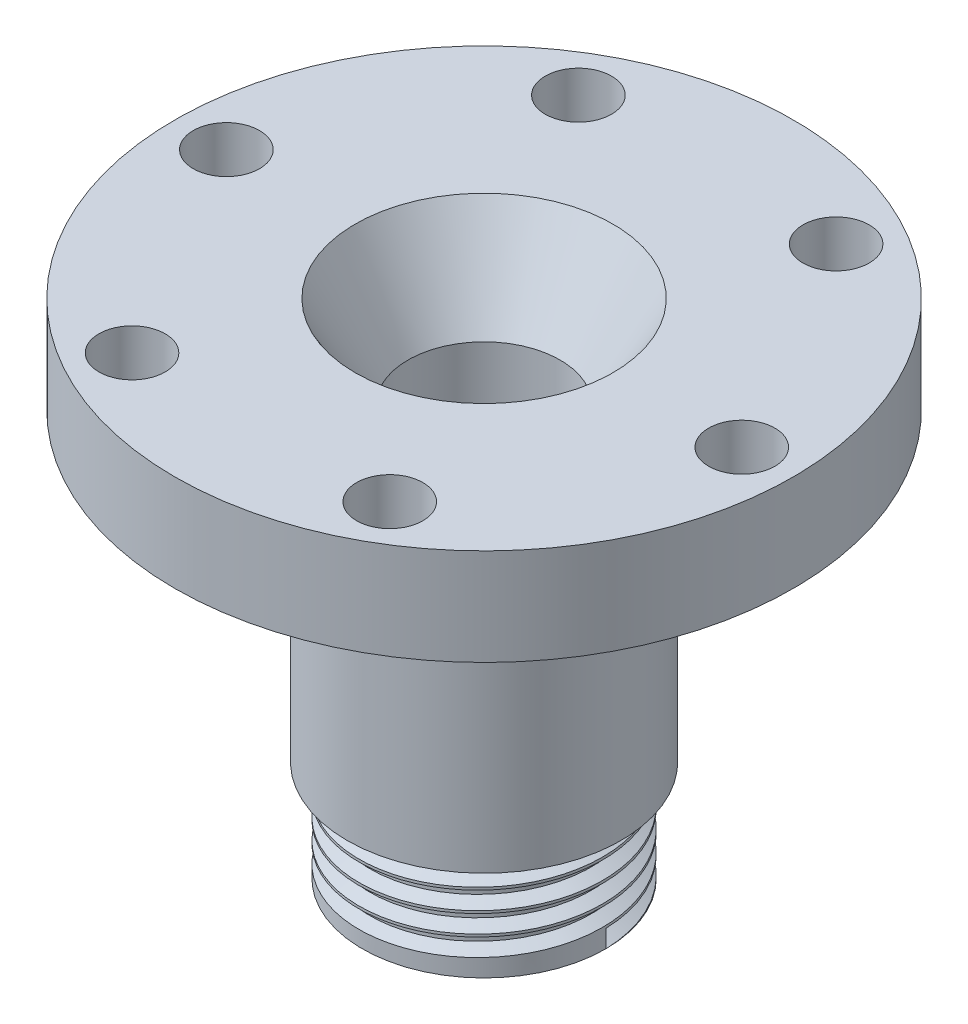
from build123d import *

# Parameters (mm, degrees)
F_1_4_CLEARANCE_HOLE1_D = 6.5278
CIRPATTERN1_COUNT       = 6
CHAMFER2_SIZE           = 3.175
SKETCH6_R               = 14.166458521
SKETCH6_R_2             = 12
CUT_EXTRUDE1_DEPTH      = 10
THREAD1_PITCH           = 2


with BuildPart() as part:
    # Sketch1 → Revolve1 (revolve)
    with BuildSketch(Plane.XY, mode=Mode.PRIVATE) as revolve1_sk:
        Polygon((7.5, -49.525), (7.5, -9.006664199), (12.7, 0), (30.48, 0), (30.48, -9.525), (13.5, -9.525), (13.5, -49.525), align=None)
    revolve(revolve1_sk.sketch.rotate(Axis((0, 0, 0), (0, -1, 0)), 90), axis=Axis((0, 0, 0), (0, -1, 0)))

    # 1/4 Clearance Hole1 (through all)
    with Locations(Plane(origin=(0, 0, 0), x_dir=(1, 0, 0), z_dir=(0, 1, 0))):
        with Locations((25.4, 0)):
            f_1_4_clearance_hole1 = Hole(F_1_4_CLEARANCE_HOLE1_D / 2)

    # CirPattern1: 1/4 Clearance Hole1 ×6 about axis
    cirpattern1_axis = Axis((0, 0, 0), (0, 1, 0))
    for i in range(1, CIRPATTERN1_COUNT):
        add(f_1_4_clearance_hole1.rotate(cirpattern1_axis, i * 360 / CIRPATTERN1_COUNT), mode=Mode.SUBTRACT)

    # Chamfer2
    chamfer2_edges = [part.edges().sort_by_distance(p)[0] for p in [
        (0, -9.525, -13.5),
    ]]
    chamfer(chamfer2_edges, length=CHAMFER2_SIZE)

    # Sketch6 → Cut-Extrude1 (cut)
    with BuildSketch(Plane(origin=(0, -49.525, 0), x_dir=(-1, 0, 0), z_dir=(0, -1, 0))):
        Circle(SKETCH6_R)
        with Locations(Location((0, 0, 0), (0, 0, 90))):
            Circle(SKETCH6_R_2, mode=Mode.SUBTRACT)
    extrude(amount=-CUT_EXTRUDE1_DEPTH, mode=Mode.SUBTRACT)

    # Thread1: the profile of Thread Profile2 profile screwed along a right-hand helix of 5 turns, 10 arcs to a turn; built about Z, then put on its axis
    thread1_z = Axis((0, 0, 0), (0, 0, 1))
    thread1_corners = [(12.0003, 0, -0.000173205), (12.0003, 0, 1.7501732), (10.91746825, 0, 1.124999997), (10.91746825, 0, 0.624999997)]
    with BuildLine(mode=Mode.PRIVATE) as thread1_profile:
        Line(thread1_corners[0], thread1_corners[1])
        Line(thread1_corners[1], thread1_corners[2])
        Line(thread1_corners[2], thread1_corners[3])
        Line(thread1_corners[3], thread1_corners[0])
    thread1_cap = Face(thread1_profile.wire())
    thread1_turn_angles = [0, 18, 36, 54, 72, 90, 108, 126, 144, 162, 180, 198, 216, 234, 252, 270, 288, 306, 324, 342, 360]
    thread1_turn_weights = [1, 0.9510565162951535, 1, 0.9510565162951535, 1, 0.9510565162951535, 1, 0.9510565162951535, 1, 0.9510565162951535, 1, 0.9510565162951535, 1, 0.9510565162951535, 1, 0.9510565162951535, 1, 0.9510565162951535, 1, 0.9510565162951535, 1]
    thread1_turn_rails = [Edge.make_bspline([Vector(p[0], p[1], 0).rotate(thread1_z, thread1_turn_angles[k]) / thread1_turn_weights[k] + Vector(0, 0, p[2] + THREAD1_PITCH * thread1_turn_angles[k] / 360) for k in range(21)], [0, 0, 0, 1, 1, 2, 2, 3, 3, 4, 4, 5, 5, 6, 6, 7, 7, 8, 8, 9, 9, 10, 10, 10], 2, thread1_turn_weights) for p in thread1_corners]
    thread1_turn_sides = [Face.make_surface_from_curves(thread1_turn_rails[p[0]], thread1_turn_rails[p[1]]) for p in [(0, 1), (1, 2), (2, 3), (3, 0)]]
    thread1 = Plane(origin=(0, -49.525, 0), x_dir=(1, 0, 0), z_dir=(0, 1, 0)) * Solid(Shell([*[p.moved(Location((0, 0, THREAD1_PITCH * i))) for i in range(5) for p in thread1_turn_sides], thread1_cap, thread1_cap.rotate(thread1_z, 1800).moved(Location((0, 0, THREAD1_PITCH * 1800 / 360)))]))
    add(thread1, mode=Mode.SUBTRACT)


solid = part.part
